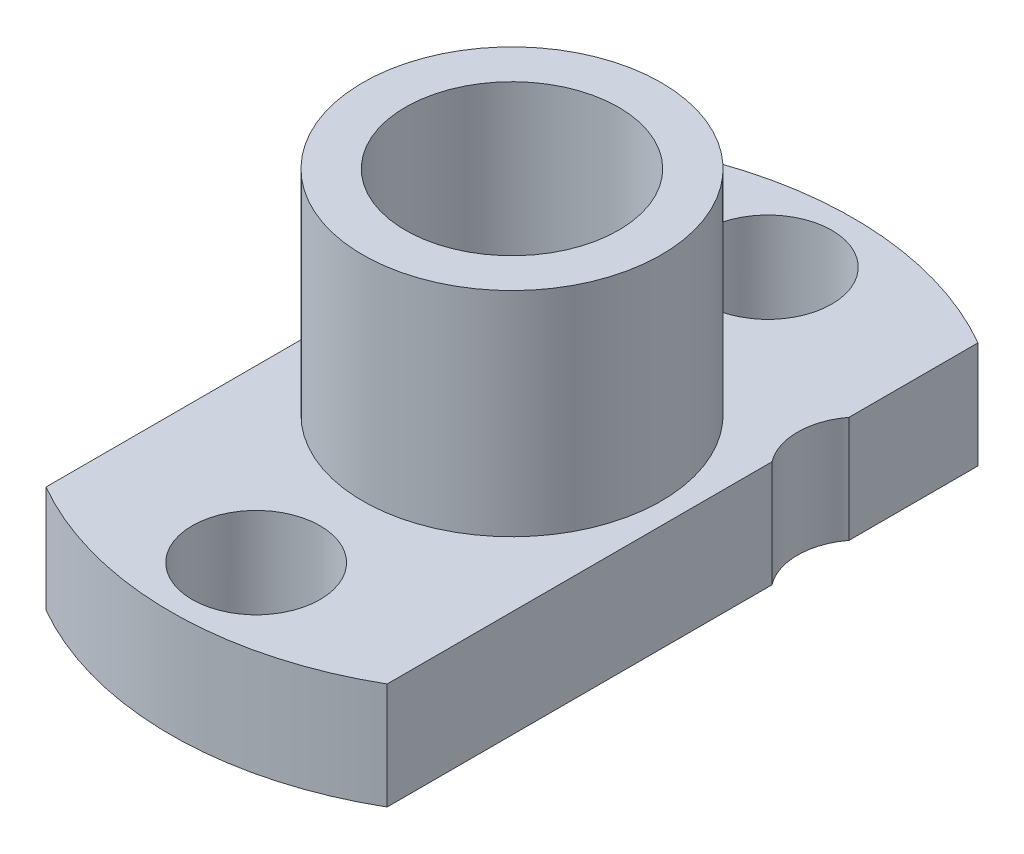
from build123d import *

# Parameters (mm, degrees)
ESQUISSE2_R             = 1.5
ENL_V_MAT_EXTRU_1_DEPTH = 14.57387196
ESQUISSE3_OUTSIDE_W     = 22.768
ESQUISSE3_OUTSIDE_H     = 22.768
ESQUISSE3_OUTSIDE_W_2   = 8
ESQUISSE3_OUTSIDE_H_2   = 16
ENL_V_MAT_EXTRU_2_DEPTH = 14.57387196


with BuildPart() as part:
    # Esquisse1 → Révolution1 (revolve)
    with BuildSketch(Plane.XY):
        Polygon((2.5, 0), (8, 0), (8, 2.5), (3.5, 2.5), (3.5, 7.5), (2.5, 7.5), align=None)
    revolve(axis=Axis((0, 0, 0), (0, 1, 0)))

    # Esquisse2 → Enlèv. mat.-Extru.1 (cut, through all)
    with BuildSketch(Plane.XZ):
        with Locations((0, 6)):
            Circle(ESQUISSE2_R)
        with Locations((5.196152423, -3)):
            Circle(ESQUISSE2_R)
        with Locations((-5.196152423, -3)):
            Circle(ESQUISSE2_R)
        with Locations((0, -6)):
            Circle(ESQUISSE2_R)
    extrude(amount=-ENL_V_MAT_EXTRU_1_DEPTH, mode=Mode.SUBTRACT)

    # Esquisse3 outside → Enlèv. mat.-Extru.2 (cut, through all)
    with BuildSketch(Plane.XZ):
        Rectangle(ESQUISSE3_OUTSIDE_W, ESQUISSE3_OUTSIDE_H)
        Rectangle(ESQUISSE3_OUTSIDE_W_2, ESQUISSE3_OUTSIDE_H_2, mode=Mode.SUBTRACT)
    extrude(amount=-ENL_V_MAT_EXTRU_2_DEPTH, mode=Mode.SUBTRACT)


solid = part.part
